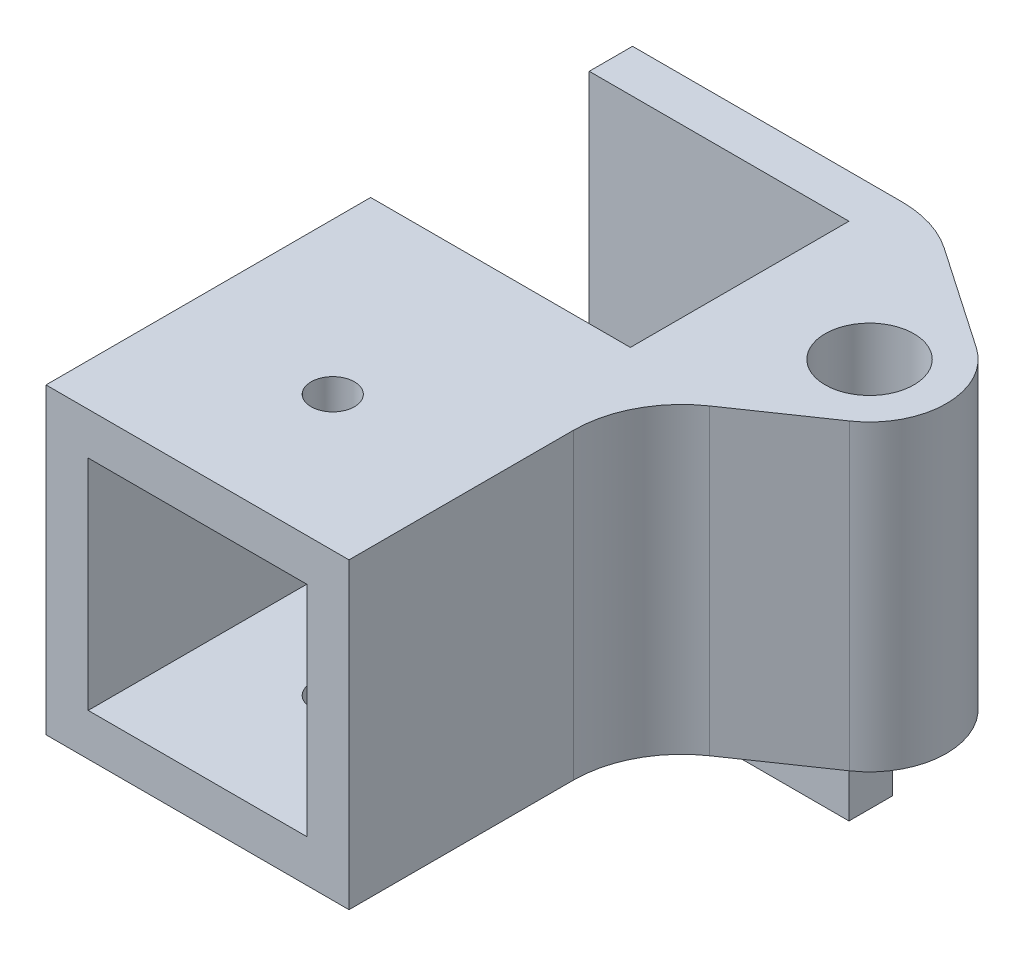
from build123d import *

# Parameters (mm, degrees)
SKETCH1_R           = 4.1
BOSS_EXTRUDE1_DEPTH = 28
SKETCH2_W           = 20.2
SKETCH2_H           = 20.2
CUT_EXTRUDE1_DEPTH  = 25
SKETCH3_R           = 2
CUT_EXTRUDE2_DEPTH  = 75.694377298
FILLET1_R           = 10
SKETCH4_W           = 24
SKETCH4_H           = 4
BOSS_EXTRUDE2_DEPTH = 20
CUT_EXTRUDE3_DEPTH  = 66.556387942


with BuildPart() as part:
    # Sketch1 → Boss-Extrude1 (new body)
    with BuildSketch(Plane(origin=(0, 0, 0), x_dir=(1, 0, 0), z_dir=(0, 1, 0))):
        with BuildLine():
            Line((28, 54.2), (0, 54.2))
            Line((0, 54.2), (0, 50.2))
            Line((0, 50.2), (24, 50.2))
            Line((24, 50.2), (24, 30))
            Line((24, 30), (0, 30))
            Line((0, 30), (0, 0))
            Line((0, 0), (28, 0))
            Line((28, 0), (28, 26))
            Line((28, 26), (40.017039194, 34.245651521))
            ThreePointArc((40.017039194, 34.245651521), (43.1, 40.1), (40.017039194, 45.954348479))
            Line((40.017039194, 45.954348479), (28, 54.2))
        make_face()
        with Locations((36, 40.1)):
            Circle(SKETCH1_R, mode=Mode.SUBTRACT)
    extrude(amount=BOSS_EXTRUDE1_DEPTH)

    # Sketch2 → Cut-Extrude1 (cut)
    with BuildSketch(Plane.XY):
        with Locations((14, 14)):
            Rectangle(SKETCH2_W, SKETCH2_H)
    extrude(amount=-CUT_EXTRUDE1_DEPTH, mode=Mode.SUBTRACT)

    # Sketch3 → Cut-Extrude2 (cut, through all)
    with BuildSketch(Plane(origin=(0, 28, 0), x_dir=(1, 0, 0), z_dir=(0, 1, 0))):
        with Locations((14, 12.5)):
            Circle(SKETCH3_R)
    extrude(amount=-CUT_EXTRUDE2_DEPTH, mode=Mode.SUBTRACT)

    # Fillet1
    fillet1_edges = [part.edges().sort_by_distance(p)[0] for p in [
        (28, 14, -54.2),
        (28, 14, -26),
    ]]
    fillet(fillet1_edges, radius=FILLET1_R)

    # Sketch4 → Boss-Extrude2 (add)
    with BuildSketch(Plane.XZ):
        with Locations((12, -52.2)):
            Rectangle(SKETCH4_W, SKETCH4_H)
    extrude(amount=BOSS_EXTRUDE2_DEPTH)

    # Sketch5 → Cut-Extrude3 (cut, through all)
    with BuildSketch(Plane(origin=(24, 0, 0), x_dir=(0, 0, -1), z_dir=(1, 0, 0))):
        Polygon((54.2, -11.327905619), (54.2, -8.672094381), (51.9, -10), align=None)
    extrude(amount=-CUT_EXTRUDE3_DEPTH, mode=Mode.SUBTRACT)


solid = part.part
